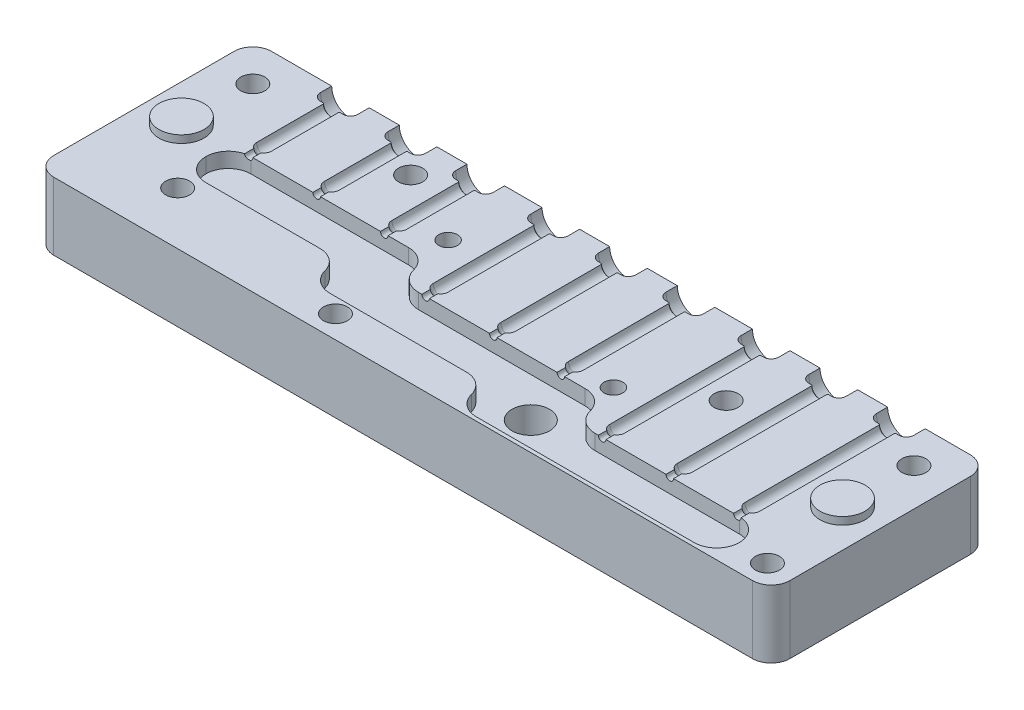
from build123d import *

# Parameters (mm, degrees)
SKIZZE1_W                       = 98
SKIZZE1_H                       = 29
AUFSATZ_LINEAR_AUSTRAGEN1_DEPTH = 9
SKIZZE2_R                       = 1
SCHNITT_LINEAR_AUSTRAGEN1_DEPTH = 12.5
VERRUNDUNG5_R                   = 2.5
SKIZZE2_4_R                     = 1
SCHNITT_LINEAR_AUSTRAGEN2_DEPTH = 17
SKIZZE2_5_R                     = 1
SCHNITT_LINEAR_AUSTRAGEN3_DEPTH = 21.5
SKIZZE4_R                       = 2.5
SCHNITT_LINEAR_AUSTRAGEN4_DEPTH = 2.5
VERRUNDUNG1_R                   = 1
FASE1_SIZE                      = 0.1
SCHNITT_LINEAR_AUSTRAGEN5_DEPTH = 0.25
SCHNITT_LINEAR_AUSTRAGEN6_DEPTH = 2
SCHNITT_LINEAR_AUSTRAGEN7_REACH = 104.44
SKIZZE7_R                       = 2.5
VERRUNDUNG2_R                   = 3
VERRUNDUNG6_R                   = 3
SCHNITT_LINEAR_AUSTRAGEN8_REACH = 104.596
DURCHGANGSLOCH_F_R_M31_D        = 3.2
M3_GEWINDEBOHRUNG1_D            = 2.5
SKIZZE10_R                      = 3
AUFSATZ_LINEAR_AUSTRAGEN2_DEPTH = 1


with BuildPart() as part:
    # Skizze1 → Aufsatz-Linear austragen1 (new body)
    with BuildSketch(Plane(origin=(0, 0, 0), x_dir=(1, 0, 0), z_dir=(0, 1, 0))):
        with Locations((49, 14.5)):
            Rectangle(SKIZZE1_W, SKIZZE1_H)
    extrude(amount=AUFSATZ_LINEAR_AUSTRAGEN1_DEPTH)

    # Skizze2 → Schnitt-Linear austragen1 (cut)
    with BuildSketch(Plane(origin=(0, 0, -29), x_dir=(-1, 0, 0), z_dir=(0, 0, -1))):
        with Locations((-13, 9)):
            Circle(SKIZZE2_R)
        with Locations((-22, 9)):
            Circle(SKIZZE2_R)
        with Locations((-31, 9)):
            Circle(SKIZZE2_R)
    extrude(amount=-SCHNITT_LINEAR_AUSTRAGEN1_DEPTH, mode=Mode.SUBTRACT)

    # Verrundung5
    verrundung5_edges = [part.edges().sort_by_distance(p)[0] for p in [
        (0, 4.5, -29),
        (98, 4.5, -29),
        (98, 4.5, 0),
        (0, 4.5, 0),
    ]]
    fillet(verrundung5_edges, radius=VERRUNDUNG5_R)

    # Skizze2<4> → Schnitt-Linear austragen2 (cut)
    with BuildSketch(Plane(origin=(0, 0, -29), x_dir=(-1, 0, 0), z_dir=(0, 0, -1))):
        with Locations((-41, 9)):
            Circle(SKIZZE2_4_R)
        with Locations((-50, 9)):
            Circle(SKIZZE2_4_R)
        with Locations((-59, 9)):
            Circle(SKIZZE2_4_R)
    extrude(amount=-SCHNITT_LINEAR_AUSTRAGEN2_DEPTH, mode=Mode.SUBTRACT)

    # Skizze2<5> → Schnitt-Linear austragen3 (cut)
    with BuildSketch(Plane(origin=(0, 0, -29), x_dir=(-1, 0, 0), z_dir=(0, 0, -1))):
        with Locations((-69, 9)):
            Circle(SKIZZE2_5_R)
        with Locations((-78, 9)):
            Circle(SKIZZE2_5_R)
        with Locations((-87, 9)):
            Circle(SKIZZE2_5_R)
    extrude(amount=-SCHNITT_LINEAR_AUSTRAGEN3_DEPTH, mode=Mode.SUBTRACT)

    # Skizze4 → Schnitt-Linear austragen4 (cut)
    with BuildSketch(Plane(origin=(0, 0, -29), x_dir=(-1, 0, 0), z_dir=(0, 0, -1))):
        with Locations((-13, 9)):
            Circle(SKIZZE4_R)
        with Locations((-22, 9)):
            Circle(SKIZZE4_R)
        with Locations((-31, 9)):
            Circle(SKIZZE4_R)
        with Locations((-41, 9)):
            Circle(SKIZZE4_R)
        with Locations((-50, 9)):
            Circle(SKIZZE4_R)
        with Locations((-59, 9)):
            Circle(SKIZZE4_R)
        with Locations((-69, 9)):
            Circle(SKIZZE4_R)
        with Locations((-78, 9)):
            Circle(SKIZZE4_R)
        with Locations((-87, 9)):
            Circle(SKIZZE4_R)
    extrude(amount=-SCHNITT_LINEAR_AUSTRAGEN4_DEPTH, mode=Mode.SUBTRACT)

    # Verrundung1
    verrundung1_edges = [part.edges().sort_by_distance(p)[0] for p in [
        (87, 6.5, -26.5),
        (78, 6.5, -26.5),
        (69, 6.5, -26.5),
        (59, 6.5, -26.5),
        (50, 6.5, -26.5),
        (41, 6.5, -26.5),
        (31, 6.5, -26.5),
        (22, 6.5, -26.5),
        (13, 6.5, -26.5),
        (13, 8, -16.5),
        (22, 8, -16.5),
        (31, 8, -16.5),
        (41, 8, -12),
        (50, 8, -12),
        (59, 8, -12),
        (69, 8, -7.5),
        (78, 8, -7.5),
        (87, 8, -7.5),
    ]]
    fillet(verrundung1_edges, radius=VERRUNDUNG1_R - 0.0001)  # a hair under: the kernel refuses the full size

    # Fase1
    fase1_edges = [part.edges().sort_by_distance(p)[0] for p in [
        (13, 8, -26.5),
        (22, 8, -26.5),
        (31, 8, -26.5),
        (41, 8, -26.5),
        (50, 8, -26.5),
        (59, 8, -26.5),
        (69, 8, -26.5),
        (78, 8, -26.5),
        (87, 8, -26.5),
    ]]
    chamfer(fase1_edges, length=FASE1_SIZE)

    # Skizze5 → Schnitt-Linear austragen5 (cut)
    with BuildSketch(Plane(origin=(0, 9, 0), x_dir=(1, 0, 0), z_dir=(0, 1, 0))):
        Polygon((12.75, 15.5), (13, 15.5), (13.25, 15.5), (13.25, 17.5), (12.75, 17.5), align=None)
        Polygon((40.75, 11), (41, 11), (41.25, 11), (41.25, 13), (40.75, 13), align=None)
        Polygon((21.75, 15.5), (22, 15.5), (22.25, 15.5), (22.25, 17.5), (21.75, 17.5), align=None)
        Polygon((68.75, 6.5), (69, 6.5), (69.25, 6.5), (69.25, 8.5), (68.75, 8.5), align=None)
        Polygon((49.75, 11), (50, 11), (50.25, 11), (50.25, 13), (49.75, 13), align=None)
        Polygon((30.75, 15.5), (31, 15.5), (31.25, 15.5), (31.25, 17.5), (30.75, 17.5), align=None)
        Polygon((58.75, 11), (59, 11), (59.25, 11), (59.25, 13), (58.75, 13), align=None)
        Polygon((77.75, 6.5), (78, 6.5), (78.25, 6.5), (78.25, 8.5), (77.75, 8.5), align=None)
        Polygon((86.75, 6.5), (87, 6.5), (87.25, 6.5), (87.25, 8.5), (86.75, 8.5), align=None)
    extrude(amount=-SCHNITT_LINEAR_AUSTRAGEN5_DEPTH, mode=Mode.SUBTRACT)

    # Skizze6 → Schnitt-Linear austragen6 (cut)
    with BuildSketch(Plane(origin=(0, 9, 0), x_dir=(1, 0, 0), z_dir=(0, 1, 0))):
        Polygon((37.25, 15.5), (10.25, 15.5), (10.25, 9.5), (31.25, 9.5), (31.25, 5), (55.25, 5), (55.25, 0.5), (90.25, 0.5), (90.25, 6.5), (65.25, 6.5), (65.25, 11), (37.25, 11), align=None)
    extrude(amount=-SCHNITT_LINEAR_AUSTRAGEN6_DEPTH, mode=Mode.SUBTRACT)

    # Skizze7 → Schnitt-Linear austragen7 (cut, up to next)
    with BuildSketch(Plane(origin=(0, 7, 0), x_dir=(1, 0, 0), z_dir=(0, 1, 0)), mode=Mode.PRIVATE) as schnitt_linear_austragen7_sk1:
        with Locations(Location((60.25, 5.75, 0), (0, 0, 270))):
            Circle(SKIZZE7_R)
    schnitt_linear_austragen7_tool1 = extrude(schnitt_linear_austragen7_sk1.sketch, amount=-SCHNITT_LINEAR_AUSTRAGEN7_REACH, mode=Mode.PRIVATE) & part.part
    add(schnitt_linear_austragen7_tool1.solids().sort_by_distance((60.25, 7, -5.75))[0], mode=Mode.SUBTRACT)

    # Verrundung2
    verrundung2_edges = [part.edges().sort_by_distance(p)[0] for p in [
        (90.25, 8, -0.5),
        (90.25, 8, -6.5),
        (65.25, 8, -11),
        (55.25, 8, -0.5),
        (37.25, 8, -15.5),
        (31.25, 8, -5),
        (10.25, 8, -9.5),
        (10.25, 8, -15.5),
    ]]
    fillet(verrundung2_edges, radius=VERRUNDUNG2_R - 0.0001)  # a hair under: the kernel refuses the full size

    # Verrundung6
    verrundung6_edges = [part.edges().sort_by_distance(p)[0] for p in [
        (65.25, 8, -6.5),
        (55.25, 8, -5),
        (31.25, 8, -9.5),
        (37.25, 8, -11),
    ]]
    fillet(verrundung6_edges, radius=VERRUNDUNG6_R)

    # Skizze15 → Schnitt-Linear austragen8 (cut, up to next)
    with BuildSketch(Plane(origin=(0, 0, -29), x_dir=(-1, 0, 0), z_dir=(0, 0, -1)), mode=Mode.PRIVATE) as schnitt_linear_austragen8_sk1:
        with BuildLine():
            Line((-87.5, 9), (-86.5, 9))
            ThreePointArc((-86.5, 9), (-87, 8.5), (-87.5, 9))
        make_face()
    schnitt_linear_austragen8_tool1 = extrude(schnitt_linear_austragen8_sk1.sketch, amount=-SCHNITT_LINEAR_AUSTRAGEN8_REACH, mode=Mode.PRIVATE) & part.part
    # Skizze15 → Schnitt-Linear austragen8 (cut, up to next)
    with BuildSketch(Plane(origin=(0, 0, -29), x_dir=(-1, 0, 0), z_dir=(0, 0, -1)), mode=Mode.PRIVATE) as schnitt_linear_austragen8_sk2:
        with BuildLine():
            Line((-78.5, 9), (-77.5, 9))
            ThreePointArc((-77.5, 9), (-78, 8.5), (-78.5, 9))
        make_face()
    schnitt_linear_austragen8_tool2 = extrude(schnitt_linear_austragen8_sk2.sketch, amount=-SCHNITT_LINEAR_AUSTRAGEN8_REACH, mode=Mode.PRIVATE) & part.part
    # Skizze15 → Schnitt-Linear austragen8 (cut, up to next)
    with BuildSketch(Plane(origin=(0, 0, -29), x_dir=(-1, 0, 0), z_dir=(0, 0, -1)), mode=Mode.PRIVATE) as schnitt_linear_austragen8_sk3:
        with BuildLine():
            Line((-69.5, 9), (-68.5, 9))
            ThreePointArc((-68.5, 9), (-69, 8.5), (-69.5, 9))
        make_face()
    schnitt_linear_austragen8_tool3 = extrude(schnitt_linear_austragen8_sk3.sketch, amount=-SCHNITT_LINEAR_AUSTRAGEN8_REACH, mode=Mode.PRIVATE) & part.part
    # Skizze15 → Schnitt-Linear austragen8 (cut, up to next)
    with BuildSketch(Plane(origin=(0, 0, -29), x_dir=(-1, 0, 0), z_dir=(0, 0, -1)), mode=Mode.PRIVATE) as schnitt_linear_austragen8_sk4:
        with BuildLine():
            Line((-59.5, 9), (-58.5, 9))
            ThreePointArc((-58.5, 9), (-59, 8.5), (-59.5, 9))
        make_face()
    schnitt_linear_austragen8_tool4 = extrude(schnitt_linear_austragen8_sk4.sketch, amount=-SCHNITT_LINEAR_AUSTRAGEN8_REACH, mode=Mode.PRIVATE) & part.part
    # Skizze15 → Schnitt-Linear austragen8 (cut, up to next)
    with BuildSketch(Plane(origin=(0, 0, -29), x_dir=(-1, 0, 0), z_dir=(0, 0, -1)), mode=Mode.PRIVATE) as schnitt_linear_austragen8_sk5:
        with BuildLine():
            Line((-50.5, 9), (-49.5, 9))
            ThreePointArc((-49.5, 9), (-50, 8.5), (-50.5, 9))
        make_face()
    schnitt_linear_austragen8_tool5 = extrude(schnitt_linear_austragen8_sk5.sketch, amount=-SCHNITT_LINEAR_AUSTRAGEN8_REACH, mode=Mode.PRIVATE) & part.part
    # Skizze15 → Schnitt-Linear austragen8 (cut, up to next)
    with BuildSketch(Plane(origin=(0, 0, -29), x_dir=(-1, 0, 0), z_dir=(0, 0, -1)), mode=Mode.PRIVATE) as schnitt_linear_austragen8_sk6:
        with BuildLine():
            Line((-41.5, 9), (-40.5, 9))
            ThreePointArc((-40.5, 9), (-41, 8.5), (-41.5, 9))
        make_face()
    schnitt_linear_austragen8_tool6 = extrude(schnitt_linear_austragen8_sk6.sketch, amount=-SCHNITT_LINEAR_AUSTRAGEN8_REACH, mode=Mode.PRIVATE) & part.part
    # Skizze15 → Schnitt-Linear austragen8 (cut, up to next)
    with BuildSketch(Plane(origin=(0, 0, -29), x_dir=(-1, 0, 0), z_dir=(0, 0, -1)), mode=Mode.PRIVATE) as schnitt_linear_austragen8_sk7:
        with BuildLine():
            Line((-31.5, 9), (-30.5, 9))
            ThreePointArc((-30.5, 9), (-31, 8.5), (-31.5, 9))
        make_face()
    schnitt_linear_austragen8_tool7 = extrude(schnitt_linear_austragen8_sk7.sketch, amount=-SCHNITT_LINEAR_AUSTRAGEN8_REACH, mode=Mode.PRIVATE) & part.part
    # Skizze15 → Schnitt-Linear austragen8 (cut, up to next)
    with BuildSketch(Plane(origin=(0, 0, -29), x_dir=(-1, 0, 0), z_dir=(0, 0, -1)), mode=Mode.PRIVATE) as schnitt_linear_austragen8_sk8:
        with BuildLine():
            Line((-22.5, 9), (-21.5, 9))
            ThreePointArc((-21.5, 9), (-22, 8.5), (-22.5, 9))
        make_face()
    schnitt_linear_austragen8_tool8 = extrude(schnitt_linear_austragen8_sk8.sketch, amount=-SCHNITT_LINEAR_AUSTRAGEN8_REACH, mode=Mode.PRIVATE) & part.part
    # Skizze15 → Schnitt-Linear austragen8 (cut, up to next)
    with BuildSketch(Plane(origin=(0, 0, -29), x_dir=(-1, 0, 0), z_dir=(0, 0, -1)), mode=Mode.PRIVATE) as schnitt_linear_austragen8_sk9:
        with BuildLine():
            Line((-13.5, 9), (-12.5, 9))
            ThreePointArc((-12.5, 9), (-13, 8.5), (-13.5, 9))
        make_face()
    schnitt_linear_austragen8_tool9 = extrude(schnitt_linear_austragen8_sk9.sketch, amount=-SCHNITT_LINEAR_AUSTRAGEN8_REACH, mode=Mode.PRIVATE) & part.part
    add(schnitt_linear_austragen8_tool1.solids().sort_by_distance((87, 8.787793, -29))[0], mode=Mode.SUBTRACT)
    add(schnitt_linear_austragen8_tool2.solids().sort_by_distance((78, 8.787793, -29))[0], mode=Mode.SUBTRACT)
    add(schnitt_linear_austragen8_tool3.solids().sort_by_distance((69, 8.787793, -29))[0], mode=Mode.SUBTRACT)
    add(schnitt_linear_austragen8_tool4.solids().sort_by_distance((59, 8.787793, -29))[0], mode=Mode.SUBTRACT)
    add(schnitt_linear_austragen8_tool5.solids().sort_by_distance((50, 8.787793, -29))[0], mode=Mode.SUBTRACT)
    add(schnitt_linear_austragen8_tool6.solids().sort_by_distance((41, 8.787793, -29))[0], mode=Mode.SUBTRACT)
    add(schnitt_linear_austragen8_tool7.solids().sort_by_distance((31, 8.787793, -29))[0], mode=Mode.SUBTRACT)
    add(schnitt_linear_austragen8_tool8.solids().sort_by_distance((22, 8.787793, -29))[0], mode=Mode.SUBTRACT)
    add(schnitt_linear_austragen8_tool9.solids().sort_by_distance((13, 8.787793, -29))[0], mode=Mode.SUBTRACT)

    # Durchgangsloch für M31 (through all)
    with Locations(Plane(origin=(0, 9, 0), x_dir=(1, 0, 0), z_dir=(0, 1, 0))):
        with Locations((26, 24), (73, 19), (93, 24), (94.5, 3), (12, 7), (5, 24), (37, 3)):
            Hole(DURCHGANGSLOCH_F_R_M31_D / 2)

    # M3 Gewindebohrung1 (through all)
    with Locations(Plane(origin=(0, 9, 0), x_dir=(1, 0, 0), z_dir=(0, 1, 0))):
        with Locations((36, 19), (64, 13)):
            Hole(M3_GEWINDEBOHRUNG1_D / 2)

    # Skizze10 → Aufsatz-Linear austragen2 (add)
    with BuildSketch(Plane(origin=(0, 9, 0), x_dir=(1, 0, 0), z_dir=(0, 1, 0))):
        with Locations(Location((93, 14.5, 0), (0, 0, 90))):
            Circle(SKIZZE10_R)
        with Locations(Location((5, 14.5, 0), (0, 0, 90))):
            Circle(SKIZZE10_R)
    extrude(amount=AUFSATZ_LINEAR_AUSTRAGEN2_DEPTH)


solid = part.part
